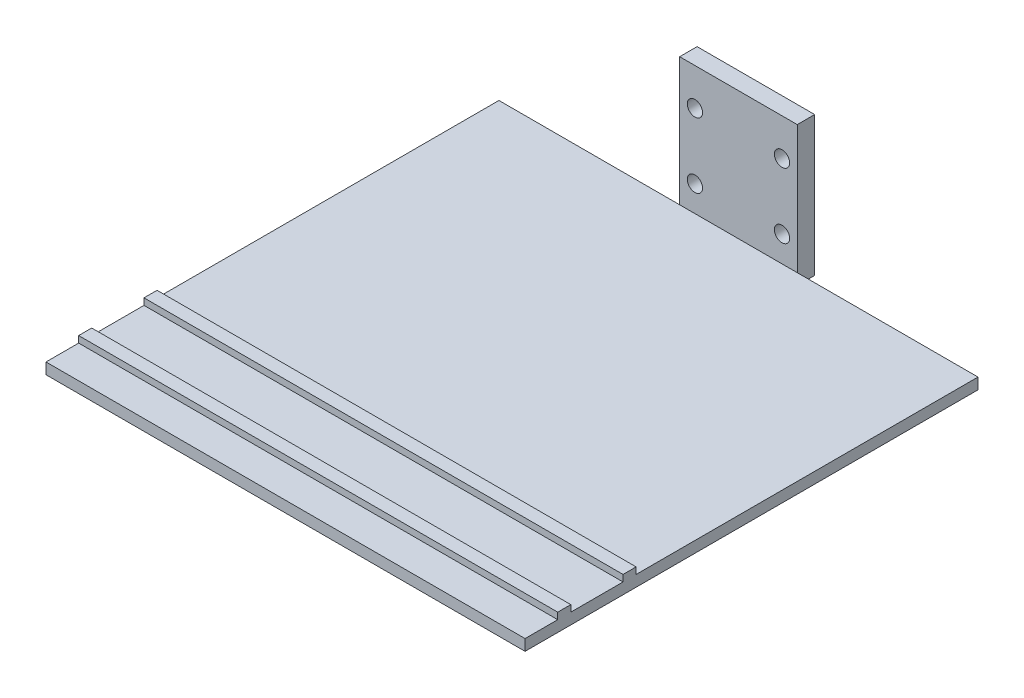
from build123d import *

# Parameters (mm, degrees)
SCHIZZO1_W                        = 27
SCHIZZO1_H                        = 36
ESTRUSIONE_ESTRUSIONE1_DEPTH      = 4
SCHIZZO10_R                       = 1.75
TAGLIO_ESTRUSIONE5_DEPTH          = 10
ESTRUSIONE_ESTRUSIONE2_DEPTH      = 55
ESTRUSIONE_ESTRUSIONE2_DEPTH_BACK = 55
SCHIZZO12_W                       = 104
SCHIZZO12_H                       = 2.549259356
SCHIZZO14_W                       = 3
SCHIZZO14_H                       = 1.5
ESTRUSIONE_ESTRUSIONE3_DEPTH      = 110
SCHIZZO15_W                       = 27
SCHIZZO15_H                       = 4
TAGLIO_ESTRUSIONE6_DEPTH          = 130.631207662


with BuildPart() as part:
    # Schizzo1 → Estrusione-Estrusione1 (new body)
    with BuildSketch(Plane.XY):
        with Locations((13.5, -18)):
            Rectangle(SCHIZZO1_W, SCHIZZO1_H)
    extrude(amount=ESTRUSIONE_ESTRUSIONE1_DEPTH)

    # Schizzo10 → Taglio-Estrusione5 (cut)
    with BuildSketch(Plane.XY.offset(4)):
        with Locations((3.5, -12.5)):
            Circle(SCHIZZO10_R)
        with Locations((23.5, -12.5)):
            Circle(SCHIZZO10_R)
        with Locations((23.5, -27.5)):
            Circle(SCHIZZO10_R)
        with Locations((3.5, -27.5)):
            Circle(SCHIZZO10_R)
    extrude(amount=-TAGLIO_ESTRUSIONE5_DEPTH, mode=Mode.SUBTRACT)

    # Schizzo12 → Estrusione-Estrusione2 (add, two sides: drawn at the far end of the back side and taken through both)
    with BuildSketch(Plane(origin=(13.5, 0, 0), x_dir=(0, 0, -1), z_dir=(1, 0, 0)).offset(-ESTRUSIONE_ESTRUSIONE2_DEPTH_BACK)):
        with Locations((-56, -34.725370322)):
            Rectangle(SCHIZZO12_W, SCHIZZO12_H)
    extrude(amount=ESTRUSIONE_ESTRUSIONE2_DEPTH + ESTRUSIONE_ESTRUSIONE2_DEPTH_BACK)

    # Schizzo14 → Estrusione-Estrusione3 (add)
    with BuildSketch(Plane.ZY.offset(41.5)):
        with Locations((84, -32.700740644)):
            Rectangle(SCHIZZO14_W, SCHIZZO14_H)
        with Locations((99, -32.700740644)):
            Rectangle(SCHIZZO14_W, SCHIZZO14_H)
    extrude(amount=-ESTRUSIONE_ESTRUSIONE3_DEPTH)

    # Schizzo15 → Taglio-Estrusione6 (cut, through all)
    with BuildSketch(Plane.XY.offset(4)):
        with Locations((13.5, -2)):
            Rectangle(SCHIZZO15_W, SCHIZZO15_H)
    extrude(amount=-TAGLIO_ESTRUSIONE6_DEPTH, mode=Mode.SUBTRACT)


solid = part.part
